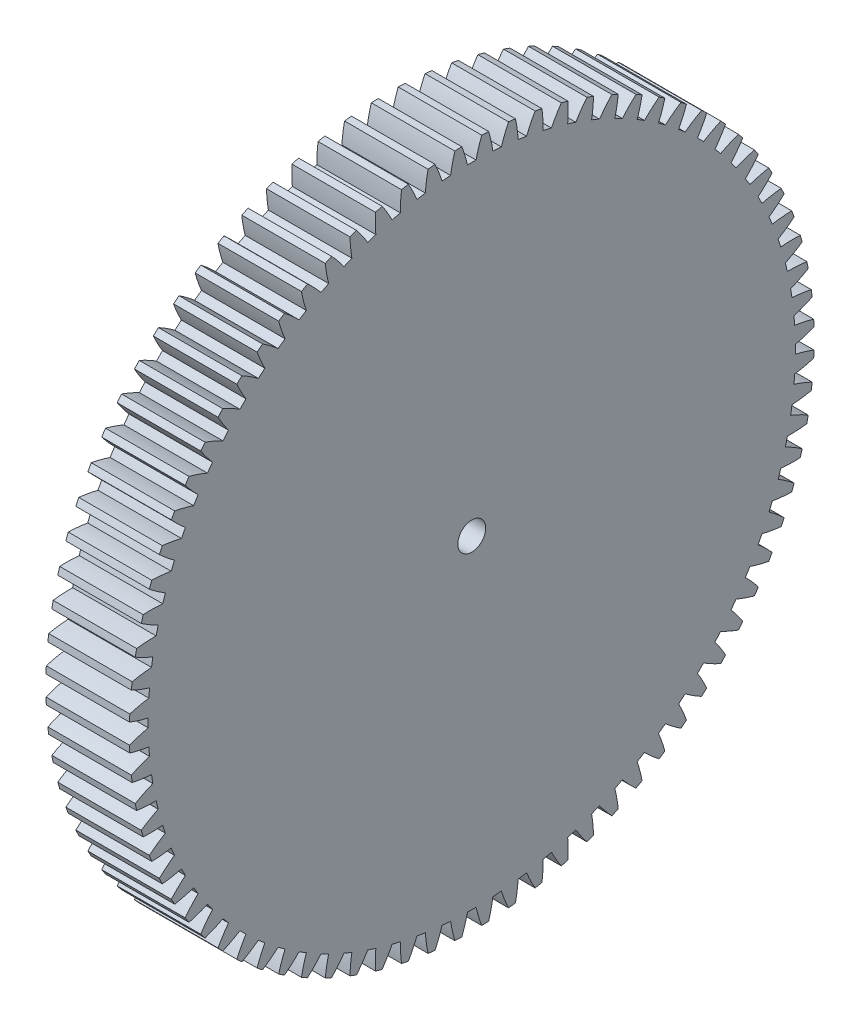
from build123d import *

# Parameters (mm, degrees)
BASPROSKE_W     = 15
BASPROSKE_H     = 61.5
TOOTHCUT_DEPTH  = 89.2581441
TEETHCUTS_COUNT = 80
BORSKE_R        = 2.5
BORE_DEPTH      = 50.0000508


with BuildPart() as part:
    # BasProSke → Base-Revolve (revolve)
    with BuildSketch(Plane(origin=(0, 0, 0), x_dir=(1, 0, 0), z_dir=(0, 1, 0))):
        with Locations((7.5, 30.75)):
            Rectangle(BASPROSKE_W, BASPROSKE_H)
    revolve(axis=Axis((-10, 0, 0), (1, 0, 0)))

    # TooCutSke → ToothCut (cut, through all)
    with BuildSketch(Plane(origin=(0, 0, 0), x_dir=(0, 0, -1), z_dir=(1, 0, 0))):
        with BuildLine():
            ThreePointArc((0.768008066, 58.11892583), (0, 58.124), (-0.768008066, 58.11892583))
            ThreePointArc((-0.768008066, 58.11892583), (-1.221763916, 59.828017283), (-1.800127149, 61.499060053))
            ThreePointArc((-1.800127149, 61.499060053), (0, 61.5254), (1.800127149, 61.499060053))
            ThreePointArc((1.800127149, 61.499060053), (1.221763916, 59.828017283), (0.768008066, 58.11892583))
        make_face()
    toothcut = extrude(amount=TOOTHCUT_DEPTH, mode=Mode.SUBTRACT)

    # TeethCuts: ToothCut ×80 about axis
    teethcuts_axis = Axis((-10, 0, 0), (1, 0, 0))
    for i in range(1, TEETHCUTS_COUNT):
        add(toothcut.rotate(teethcuts_axis, i * 360 / TEETHCUTS_COUNT), mode=Mode.SUBTRACT)

    # BorSke → Bore (cut, symmetric)
    with BuildSketch(Plane(origin=(0, 0, 0), x_dir=(0, 0, -1), z_dir=(1, 0, 0))):
        Circle(BORSKE_R)
    extrude(amount=BORE_DEPTH, both=True, mode=Mode.SUBTRACT)


solid = part.part
